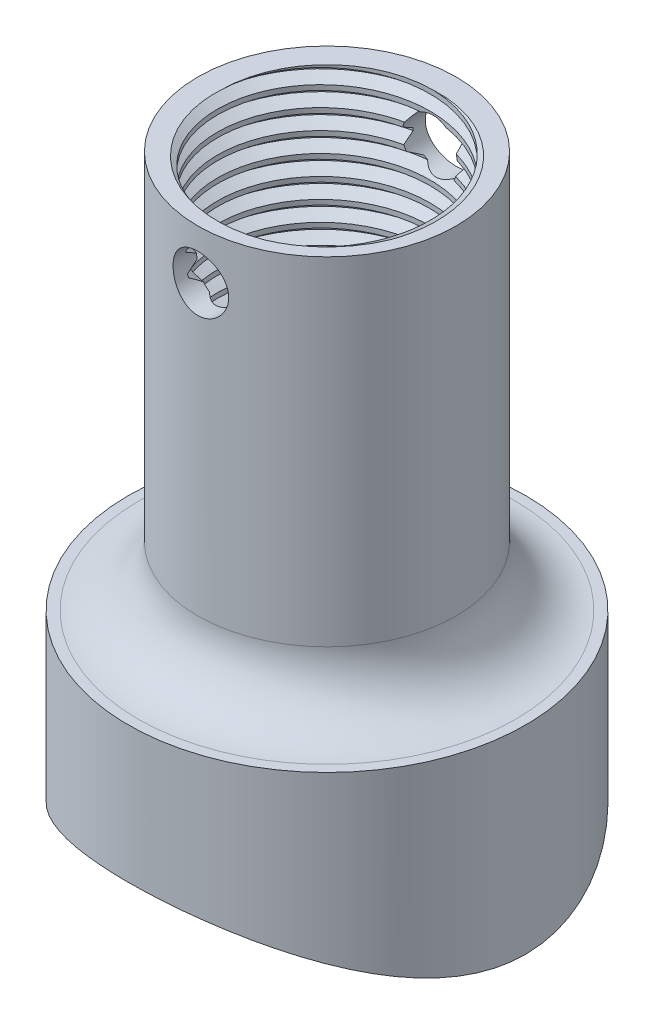
from build123d import *
from build123d.topology import SkipClean

# Parameters (mm, degrees)
SKETCH9_R               = 16.51
BOSS_EXTRUDE1_DEPTH     = 50.8
SKETCH10_R              = 25.4
BOSS_EXTRUDE2_DEPTH     = 25.4
CUT_EXTRUDE4_DEPTH      = 63.217039467
CUT_EXTRUDE4_DEPTH_BACK = 63.217039467
SKETCH11_R              = 44.45
FILLET1_R               = 7.62
SHELL1_T                = -3.175
THREAD2_PITCH           = 2.54
CUT_EXTRUDE5_DEPTH      = 63.21703963
CUT_EXTRUDE5_DEPTH_BACK = 63.21703963
SKETCH15_R              = 3.556


with BuildPart() as part:
    # Sketch9 → Boss-Extrude1 (new body)
    with BuildSketch(Plane(origin=(0, 0, 0), x_dir=(1, 0, 0), z_dir=(0, 1, 0))):
        with Locations(Location((0, 0, 0), (0, 0, 270))):
            Circle(SKETCH9_R)
    extrude(amount=BOSS_EXTRUDE1_DEPTH)

    # Sketch10 → Boss-Extrude2 (add)
    with BuildSketch(Plane.XZ):
        with Locations(Location((0, 0, 0), (0, 0, 270))):
            Circle(SKETCH10_R)
    extrude(amount=BOSS_EXTRUDE2_DEPTH)

    # Sketch11 → Cut-Extrude4 (cut, two sides: drawn at the far end of the back side and taken through both)
    with BuildSketch(Plane.XY.offset(-CUT_EXTRUDE4_DEPTH_BACK)):
        with Locations((0, -61.877972806)):
            Circle(SKETCH11_R)
    extrude(amount=CUT_EXTRUDE4_DEPTH + CUT_EXTRUDE4_DEPTH_BACK, mode=Mode.SUBTRACT)

    # Fillet1
    fillet1_edges = [part.edges().sort_by_distance(p)[0] for p in [
        (0, 0, -16.51),
    ]]
    fillet(fillet1_edges, radius=FILLET1_R)

    # Shell1
    shell1_openings = [part.faces().sort_by_distance(p)[0] for p in [
        (0, 50.8, 0),
    ]]
    offset(amount=SHELL1_T, openings=shell1_openings)

    # Move Face1: read off the stored shape, not the designer's step
    # Move Face1 outline → Move Face1 (revolve, cut)
    with BuildSketch(Plane.XY):
        with BuildLine():
            Line((13.589, 7.62), (13.589, 50.8))
            Line((13.589, 50.8), (13.335, 50.8))
            Line((13.335, 50.8), (13.335, 7.62))
            ThreePointArc((13.335, 7.62), (15.850612945, 0.692967807), (22.225, -3.005582337))
            Line((22.225, -3.005582337), (22.225, -2.747432469))
            ThreePointArc((22.225, -2.747432469), (16.030824548, 0.873442507), (13.589, 7.62))
        make_face()
    revolve(axis=Axis((0, 0, 0), (0, 1, 0)), mode=Mode.SUBTRACT)

    # Thread2: arcs per turn and ends read off the stored shape
    # Thread2: the profile of Thread Profile2 profile screwed along a right-hand helix through 18.6063 turns, 10 arcs to a turn; built about Z, then put on its axis
    with SkipClean():  # the faces are left unmerged after this step: merging them gives an invalid solid
        thread2_z = Axis((0, 0, 0), (0, 0, 1))
        thread2_corners = [(13.5887, 0, -0.000173205), (14.963815322, 0, 0.793749997), (14.963815322, 0, 1.111249997), (13.5887, 0, 1.905173198)]
        with BuildLine(mode=Mode.PRIVATE) as thread2_profile:
            Line(thread2_corners[0], thread2_corners[1])
            Line(thread2_corners[1], thread2_corners[2])
            Line(thread2_corners[2], thread2_corners[3])
            Line(thread2_corners[3], thread2_corners[0])
        thread2_cap = Face(thread2_profile.wire())
        thread2_turn_angles = [0, 18, 36, 54, 72, 90, 108, 126, 144, 162, 180, 198, 216, 234, 252, 270, 288, 306, 324, 342, 360]
        thread2_turn_weights = [1, 0.9510565162951535, 1, 0.9510565162951535, 1, 0.9510565162951535, 1, 0.9510565162951535, 1, 0.9510565162951535, 1, 0.9510565162951535, 1, 0.9510565162951535, 1, 0.9510565162951535, 1, 0.9510565162951535, 1, 0.9510565162951535, 1]
        thread2_turn_rails = [Edge.make_bspline([Vector(p[0], p[1], 0).rotate(thread2_z, thread2_turn_angles[k]) / thread2_turn_weights[k] + Vector(0, 0, p[2] + THREAD2_PITCH * thread2_turn_angles[k] / 360) for k in range(21)], [0, 0, 0, 1, 1, 2, 2, 3, 3, 4, 4, 5, 5, 6, 6, 7, 7, 8, 8, 9, 9, 10, 10, 10], 2, thread2_turn_weights) for p in thread2_corners]
        thread2_turn_sides = [Face.make_surface_from_curves(thread2_turn_rails[p[0]], thread2_turn_rails[p[1]]) for p in [(0, 1), (1, 2), (2, 3), (3, 0)]]
        thread2_last_angles = [6480, 6498, 6516, 6534, 6552, 6570, 6588, 6606, 6624, 6642, 6660, 6678, 6696, 6697.134, 6698.268]
        thread2_last_weights = [1, 0.9510565162951535, 1, 0.9510565162951535, 1, 0.9510565162951535, 1, 0.9510565162951535, 1, 0.9510565162951535, 1, 0.9510565162951535, 1, 0.9998041440942502, 1]
        thread2_last_rails = [Edge.make_bspline([Vector(p[0], p[1], 0).rotate(thread2_z, thread2_last_angles[k]) / thread2_last_weights[k] + Vector(0, 0, p[2] + THREAD2_PITCH * thread2_last_angles[k] / 360) for k in range(15)], [0, 0, 0, 1, 1, 2, 2, 3, 3, 4, 4, 5, 5, 6, 6, 7, 7, 7], 2, thread2_last_weights) for p in thread2_corners]
        thread2_last_sides = [Face.make_surface_from_curves(thread2_last_rails[p[0]], thread2_last_rails[p[1]]) for p in [(0, 1), (1, 2), (2, 3), (3, 0)]]
        thread2 = Plane(origin=(0, 53.34, 0), x_dir=(-1, 0, 0), z_dir=(0, -1, 0)) * Solid(Shell([*[p.moved(Location((0, 0, THREAD2_PITCH * i))) for i in range(18) for p in thread2_turn_sides], *thread2_last_sides, thread2_cap, thread2_cap.rotate(thread2_z, 6698.268).moved(Location((0, 0, THREAD2_PITCH * 6698.268 / 360)))]))
        add(thread2, mode=Mode.SUBTRACT)

    # Sketch15 → Cut-Extrude5 (cut, two sides: drawn at the far end of the back side and taken through both)
    with SkipClean():  # the faces are left unmerged after this step: merging them gives an invalid solid
        with BuildSketch(Plane.XY.offset(-CUT_EXTRUDE5_DEPTH_BACK)):
            with Locations((0, 44.45)):
                Circle(SKETCH15_R)
        extrude(amount=CUT_EXTRUDE5_DEPTH + CUT_EXTRUDE5_DEPTH_BACK, mode=Mode.SUBTRACT)


solid = part.part
